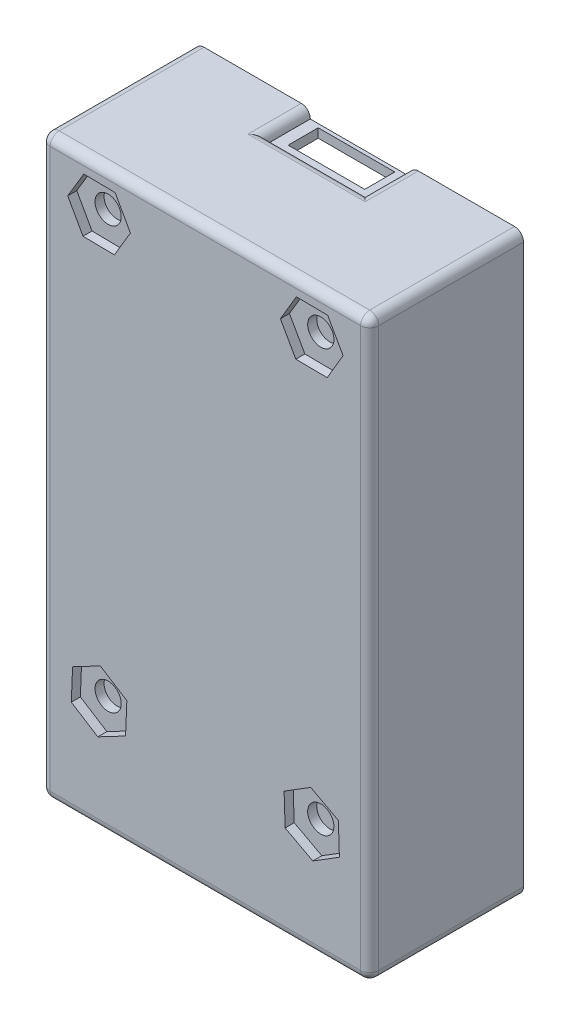
from build123d import *

# Parameters (mm, degrees)
CROQUIS1_W              = 36.3
CROQUIS1_H              = 63.7
SALIENTE_EXTRUIR1_DEPTH = 2
CROQUIS2_R              = 1.45
CORTAR_EXTRUIR1_DEPTH   = 43.35833467
CROQUIS3_W              = 36.3
CROQUIS3_H              = 63.7
CROQUIS3_W_2            = 32.3
CROQUIS3_H_2            = 59.7
SALIENTE_EXTRUIR2_DEPTH = 15
CROQUIS4_W              = 8.458215844
CROQUIS4_H              = 3.322323253
CORTAR_EXTRUIR2_DEPTH   = 15
CROQUIS5_W              = 10.947551138
CROQUIS5_H              = 4.889557179
CORTAR_EXTRUIR3_DEPTH   = 1
CROQUIS6_R              = 2.4
SALIENTE_EXTRUIR3_DEPTH = 10
REDONDEO1_R             = 1
CORTAR_EXTRUIR4_DEPTH   = 1


with BuildPart() as part:
    # Croquis1 → Saliente-Extruir1 (new body)
    with BuildSketch(Plane.XY):
        with Locations((4.435020115, -3.929119363)):
            Rectangle(CROQUIS1_W, CROQUIS1_H)
    extrude(amount=SALIENTE_EXTRUIR1_DEPTH)

    # Croquis2 → Cortar-Extruir1 (cut, through all)
    with BuildSketch(Plane(origin=(0, 0, 0), x_dir=(-1, 0, 0), z_dir=(0, 0, -1))):
        with Locations((-16.185020115, 23.120880637)):
            Circle(CROQUIS2_R)
        with Locations((7.314979885, 23.120880637)):
            Circle(CROQUIS2_R)
        with Locations((7.314979885, -23.479119363)):
            Circle(CROQUIS2_R)
        with Locations((-16.185020115, -23.479119363)):
            Circle(CROQUIS2_R)
    extrude(amount=-CORTAR_EXTRUIR1_DEPTH, mode=Mode.SUBTRACT)

    # Croquis3 → Saliente-Extruir2 (add)
    with BuildSketch(Plane(origin=(0, 0, 0), x_dir=(-1, 0, 0), z_dir=(0, 0, -1))):
        with Locations((-4.435020115, -3.929119363)):
            Rectangle(CROQUIS3_W, CROQUIS3_H)
        with Locations((-4.435020115, -3.929119363)):
            Rectangle(CROQUIS3_W_2, CROQUIS3_H_2, mode=Mode.SUBTRACT)
    extrude(amount=SALIENTE_EXTRUIR2_DEPTH)

    # Croquis4 → Cortar-Extruir2 (cut)
    with BuildSketch(Plane(origin=(0, 27.920880637, 0), x_dir=(1, 0, 0), z_dir=(0, 1, 0))):
        with Locations((4.530912193, 12.938838374)):
            Rectangle(CROQUIS4_W, CROQUIS4_H)
    extrude(amount=-CORTAR_EXTRUIR2_DEPTH, mode=Mode.SUBTRACT)

    # Croquis5 → Cortar-Extruir3 (cut)
    with BuildSketch(Plane(origin=(0, 27.920880637, 0), x_dir=(1, 0, 0), z_dir=(0, 1, 0))):
        with Locations((4.498418707, 12.555221411)):
            Rectangle(CROQUIS5_W, CROQUIS5_H)
    extrude(amount=-CORTAR_EXTRUIR3_DEPTH, mode=Mode.SUBTRACT)

    # Croquis6 → Saliente-Extruir3 (add)
    with BuildSketch(Plane(origin=(0, 0, 0), x_dir=(-1, 0, 0), z_dir=(0, 0, -1))):
        with Locations(Location((-16.185020115, 23.120880637, 0), (0, 0, 180))):
            Circle(CROQUIS6_R)
        with Locations(Location((7.314979885, 23.120880637, 0), (0, 0, 180))):
            Circle(CROQUIS6_R)
        with Locations(Location((7.314979885, -23.479119363, 0), (0, 0, 180))):
            Circle(CROQUIS6_R)
        with Locations(Location((-16.185020115, -23.479119363, 0), (0, 0, 180))):
            Circle(CROQUIS6_R)
    extrude(amount=SALIENTE_EXTRUIR3_DEPTH)

    # Redondeo1
    redondeo1_edges = [part.edges().sort_by_distance(p)[0] for p in [
        (-0.975356862, 27.920880637, -12.55522141),
        (4.498418707, 27.920880637, -10.110442821),
        (9.972194276, 27.920880637, -12.55522141),
        (22.585020115, -3.929119363, 2),
        (22.585020115, -35.779119363, -6.5),
        (4.435020115, -35.779119363, 2),
        (-13.714979885, -35.779119363, -6.5),
        (-13.714979885, -3.929119363, 2),
        (4.435020115, 27.920880637, 2),
        (-13.714979885, 27.920880637, -6.5),
        (22.585020115, 27.920880637, -6.5),
    ]]
    fillet(redondeo1_edges, radius=REDONDEO1_R - 0.0001)  # a hair under: the kernel refuses the full size

    # Croquis7 → Cortar-Extruir4 (cut)
    with BuildSketch(Plane.XY.offset(2)):
        Polygon((-5.626866213, 20.095938946), (-3.8512467, 23.070359116), (-5.539360372, 26.095300806), (-9.003093557, 26.145822327), (-10.77871307, 23.171402157), (-9.090599398, 20.146460467), align=None)
        Polygon((17.887203126, 20.103833571), (19.648951024, 23.086490833), (17.946768013, 26.103537899), (14.482837104, 26.137927702), (12.721089206, 23.15527044), (14.423272217, 20.138223374), align=None)
        Polygon((-4.386581268, -25.329654838), (-4.248169845, -21.868319506), (-7.176568462, -20.017784032), (-10.243378502, -21.628583889), (-10.381789925, -25.089919221), (-7.453391308, -26.940454695), align=None)
        Polygon((19.240442153, -25.111417183), (19.126342512, -21.649195169), (16.070920474, -20.01689735), (13.129598077, -21.846821544), (13.243697718, -25.309043558), (16.299119756, -26.941341377), align=None)
    extrude(amount=-CORTAR_EXTRUIR4_DEPTH, mode=Mode.SUBTRACT)


solid = part.part
